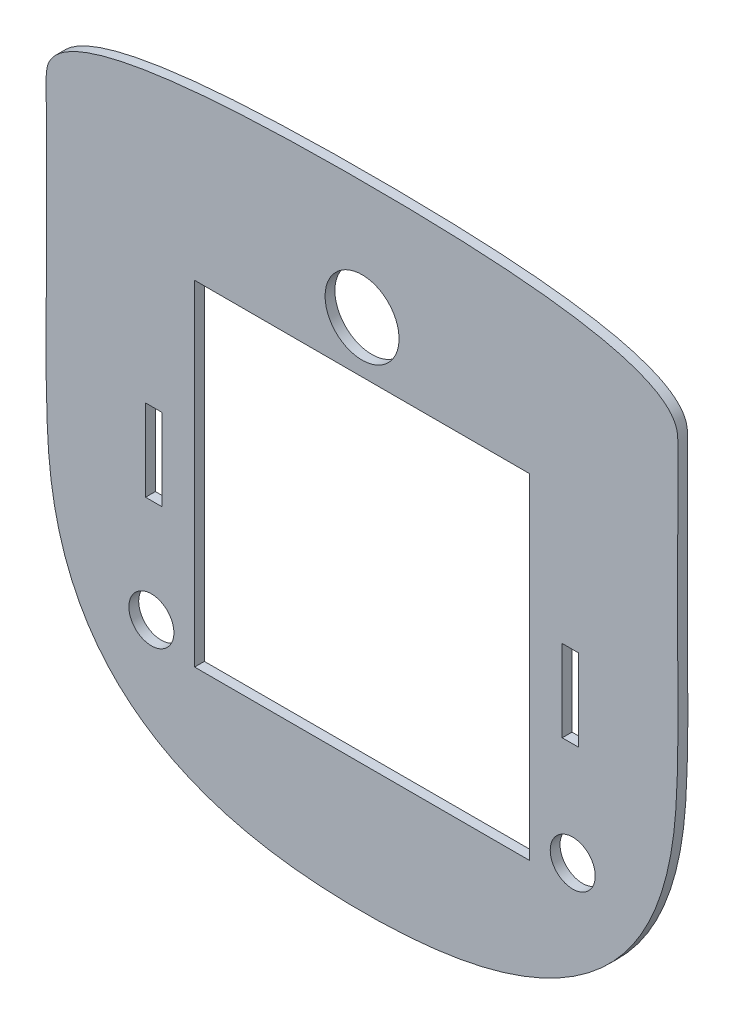
from build123d import *

# Parameters (mm, degrees)
SKETCH2_R           = 7
SKETCH2_W           = 5.08
SKETCH2_H           = 25.4
SKETCH2_R_2         = 11.5
BOSS_EXTRUDE1_DEPTH = 3.048


with BuildPart() as part:
    # Sketch2 → Boss-Extrude1 (new body)
    with BuildSketch(Plane(origin=(-0.201743714, -72.235465767, -2871.297081617), x_dir=(1, 0, 0), z_dir=(0, 0, 1))):
        with BuildLine():
            add(Edge.make_bspline(
                [(98.004062475, 101.157461169), (98.09262319, 100.582578169), (98.168282436, 99.850726468), (98.201035971, 98.964297447), (98.205576946, 98.520375047), (98.203312676, 98.076151584), (98.2036357, 97.631790351), (98.202558859, 97.187198741), (98.201774618, 96.594166212), (98.199727801, 95.555659629), (98.196350571, 94.070122586), (98.191219577, 92.28435558), (98.185300348, 90.49549016), (98.178622099, 88.703544032), (98.171344138, 86.908538509), (98.163557432, 85.110493402), (98.155396592, 83.309431675), (98.146977163, 81.505376018), (98.135573428, 79.096007637), (98.121287428, 76.076928858), (98.105071958, 72.442435741), (98.090760178, 68.796539176), (98.079583302, 65.139438492), (98.072772264, 61.471337421), (98.071088324, 57.79245144), (98.075293125, 54.103000287), (98.087402852, 50.403265868), (98.10943536, 46.693533793), (98.149097734, 41.734317266), (98.212450561, 35.511894369), (98.259787617, 28.010008132), (98.250221769, 21.731245728), (98.193919112, 16.694316231), (98.134491312, 13.540940961), (98.069931219, 11.015367159), (98.012479287, 9.119948631), (97.944993251, 7.223485327), (97.867530353, 5.326182094), (97.778046924, 3.42822235), (97.678623521, 1.529831063), (97.562359374, -0.368849117), (97.273887049, -4.165889382), (96.636661612, -9.85760728), (95.264266353, -17.392207333), (93.283204663, -24.816906824), (90.614186019, -32.040137569), (87.187668119, -38.958467556), (83.676565473, -44.359852554), (80.486245723, -48.402543782), (77.054491026, -52.240907458), (72.331970353, -56.627334171), (66.103033739, -61.188185381), (59.428677872, -65.046681648), (52.43241755, -68.244481021), (45.195675565, -70.831968561), (37.797306155, -72.863270501), (30.289713623, -74.393153681), (22.727531896, -75.494270646), (12.612681112, -76.462699086), (5.032383013, -76.714841356), (-5.035467708, -76.714845104), (-12.619786852, -76.462418803), (-22.738781506, -75.493068818), (-30.303459175, -74.391002905), (-37.812929796, -72.859918013), (-45.212549357, -70.8271864), (-52.449882097, -68.238039152), (-59.446050161, -65.038426839), (-66.11960737, -61.178042376), (-72.347079086, -56.615416709), (-77.067892297, -52.227754271), (-80.498089265, -48.388656373), (-83.686768813, -44.345422026), (-87.195743233, -38.943757554), (-90.61986046, -32.025747475), (-93.286817212, -24.803397784), (-95.266250936, -17.379993897), (-96.637448669, -9.846957631), (-97.274071314, -4.156518411), (-97.562243264, -0.360344948), (-97.678371151, 1.537899747), (-97.777873142, 3.435856699), (-97.867367387, 5.333384926), (-97.944866703, 7.230259477), (-98.01237118, 9.126297729), (-98.069845849, 11.021295221), (-98.134428193, 13.546313761), (-98.193879205, 16.699007643), (-98.250205894, 21.73487995), (-98.259784562, 28.01239372), (-98.21244762, 35.512930688), (-98.149088971, 41.734380411), (-98.109425083, 46.69292327), (-98.087392785, 50.402205892), (-98.075284257, 54.10154993), (-98.071081296, 57.790672769), (-98.072767321, 61.469295328), (-98.079580473, 65.137200586), (-98.090759277, 68.794175587), (-98.10507262, 72.440018947), (-98.121289158, 76.074533479), (-98.135575612, 79.093693997), (-98.146979553, 81.503167019), (-98.155398915, 83.307320997), (-98.163559853, 85.108501066), (-98.171346036, 86.906684767), (-98.178624384, 88.70184922), (-98.185301078, 90.493974969), (-98.19122227, 92.28304054), (-98.196348387, 94.069029013), (-98.19973362, 95.554767419), (-98.201767603, 96.593425349), (-98.202574021, 97.186545216), (-98.203601448, 97.631207844), (-98.203365989, 98.075631059), (-98.205614022, 98.519942912), (-98.200956032, 98.963909964), (-98.168457073, 99.850519984), (-98.092668955, 100.58248079), (-97.911826163, 101.756705998), (-97.591091313, 102.927189457), (-96.744501402, 104.523718023), (-95.628370708, 105.930697933), (-94.324169919, 107.14983424), (-92.908919976, 108.210412347), (-90.919547633, 109.448243636), (-88.32196599, 110.731146164), (-85.128922247, 111.980994275), (-81.907009003, 113.019085815), (-78.679652448, 113.899326262), (-75.458556986, 114.656106392), (-72.248323156, 115.314989419), (-69.051267541, 115.893006101), (-65.867703019, 116.403620435), (-62.697382089, 116.855995394), (-59.54006886, 117.258606965), (-55.346025805, 117.736366707), (-50.130480964, 118.237811213), (-43.904887694, 118.718293109), (-37.698280921, 119.100136152), (-31.497185994, 119.401363035), (-25.286074462, 119.631882756), (-19.049652571, 119.802550798), (-10.6782592, 119.95730558), (-4.311359032, 120), (4.311566967, 120), (10.678373272, 119.957301971), (19.049194344, 119.802559271), (25.285019509, 119.631912924), (31.495423882, 119.401431783), (37.695748902, 119.100264796), (43.901569172, 118.718504865), (50.126405995, 118.238134551), (55.341386835, 117.736807508), (59.535046852, 117.259158056), (62.692115597, 116.856637797), (65.862243647, 116.404363117), (69.04567768, 115.893856369), (72.242677523, 115.315956677), (75.452943985, 114.657195729), (78.674177119, 113.900542139), (81.901794523, 113.020426463), (85.124114848, 111.98245115), (88.317738818, 110.73269729), (90.915977188, 109.449832), (92.905995487, 108.211972862), (94.321790196, 107.151328604), (95.626592976, 105.93205679), (96.74337158, 104.52484085), (97.59061533, 102.927904772), (97.911707231, 101.756975983), (98.004062475, 101.157461169)],
                knots=[0, 0, 0, 0, 0.00256774, 0.003209675, 0.00385161, 0.004493545, 0.00513548, 0.005777415, 0.00641935, 0.00770322, 0.010270959, 0.012838699, 0.015406439, 0.017974179, 0.020541919, 0.023109659, 0.025677399, 0.028245138, 0.030812878, 0.035948358, 0.041083838, 0.046219318, 0.051354797, 0.056490277, 0.061625757, 0.066761236, 0.071896716, 0.077032196, 0.082167676, 0.092438635, 0.102709594, 0.112980554, 0.118116034, 0.123251513, 0.125819253, 0.128386993, 0.130954733, 0.133522473, 0.136090213, 0.138657953, 0.141225692, 0.143793432, 0.154064392, 0.164335351, 0.174606311, 0.18487727, 0.19514823, 0.205419189, 0.210554669, 0.215690148, 0.225961108, 0.236232067, 0.246503027, 0.256773986, 0.267044946, 0.277315905, 0.287586865, 0.297857824, 0.308128783, 0.328670702, 0.328670702, 0.349206929, 0.359475043, 0.369743156, 0.38001127, 0.390279383, 0.400547497, 0.41081561, 0.421083724, 0.431351837, 0.441619951, 0.446754008, 0.451888064, 0.462156178, 0.472424291, 0.482692405, 0.492960518, 0.503228632, 0.513496745, 0.516063774, 0.518630802, 0.521197831, 0.523764859, 0.526331887, 0.528898916, 0.531465944, 0.534032972, 0.539167029, 0.544301086, 0.554569199, 0.564837313, 0.575105426, 0.580239483, 0.58537354, 0.590507597, 0.595641653, 0.60077571, 0.605909767, 0.611043824, 0.61617788, 0.621311937, 0.626445994, 0.629013022, 0.631580051, 0.634147079, 0.636714107, 0.639281136, 0.641848164, 0.644415193, 0.646982221, 0.649549249, 0.650832764, 0.651474521, 0.652116278, 0.652758035, 0.653399792, 0.654041549, 0.654683306, 0.657250335, 0.657250335, 0.659928039, 0.662605744, 0.665283448, 0.667961153, 0.670638857, 0.673316562, 0.678671971, 0.68402738, 0.68938279, 0.694738199, 0.700093608, 0.705449017, 0.710804426, 0.716159836, 0.721515245, 0.726870654, 0.732226063, 0.742936882, 0.7536477, 0.764358518, 0.775069337, 0.785780155, 0.796490973, 0.807201792, 0.828623429, 0.828623429, 0.8500455, 0.860756536, 0.871467571, 0.882178607, 0.892889643, 0.903600679, 0.914311714, 0.92502275, 0.930378268, 0.935733786, 0.941089304, 0.946444821, 0.951800339, 0.957155857, 0.962511375, 0.967866893, 0.973222411, 0.978577929, 0.983933446, 0.986611205, 0.989288964, 0.991966723, 0.994644482, 0.997322241, 1, 1, 1, 1], degree=3))
        make_face()
        with Locations((-65.5, -30.887752409)):
            Circle(SKETCH2_R, mode=Mode.SUBTRACT)
        with Locations((-64.77000195, 13.912247591)):
            Rectangle(SKETCH2_W, SKETCH2_H, mode=Mode.SUBTRACT)
        Polygon((0, 67.252247902), (52.07, 67.252248214), (52.070001625, -36.887752409), (-52.07000195, -36.887752409), (-52.07000195, 67.252247591), align=None, mode=Mode.SUBTRACT)
        with Locations((65.5, -30.887752409)):
            Circle(SKETCH2_R, mode=Mode.SUBTRACT)
        with Locations((64.77000195, 13.912247591)):
            Rectangle(SKETCH2_W, SKETCH2_H, mode=Mode.SUBTRACT)
        with Locations((0, 83.287247591)):
            Circle(SKETCH2_R_2, mode=Mode.SUBTRACT)
    extrude(amount=BOSS_EXTRUDE1_DEPTH)


solid = part.part
